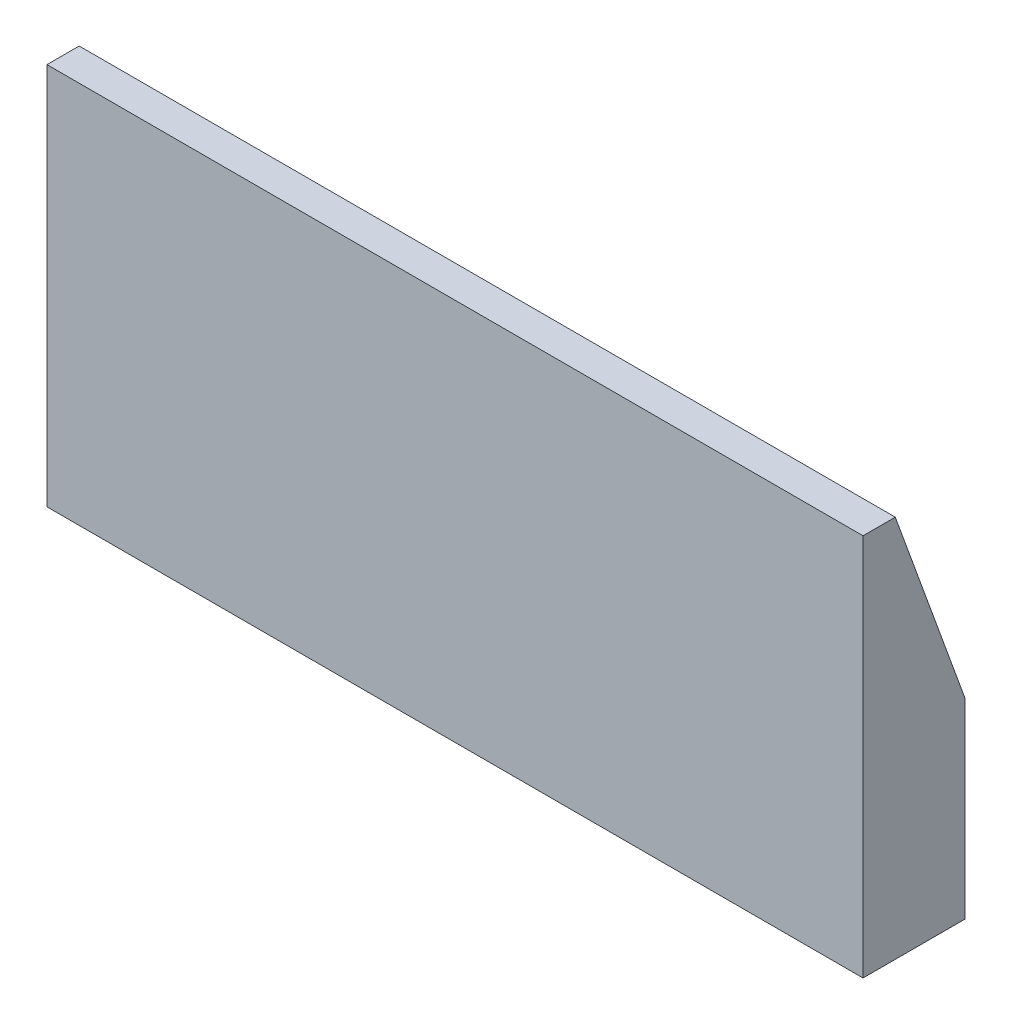
from build123d import *

# Parameters (mm, degrees)
BOSS_EXTRUDE1_DEPTH = 320


with BuildPart() as part:
    # Sketch1 → Boss-Extrude1 (new body)
    with BuildSketch(Plane(origin=(0, 0, 0), x_dir=(0, 0, -1), z_dir=(1, 0, 0))):
        Polygon((0, 0), (40, 0), (40, 75), (12.638388534, 150.175409663), (0, 150.175409663), align=None)
    extrude(amount=BOSS_EXTRUDE1_DEPTH)


solid = part.part
